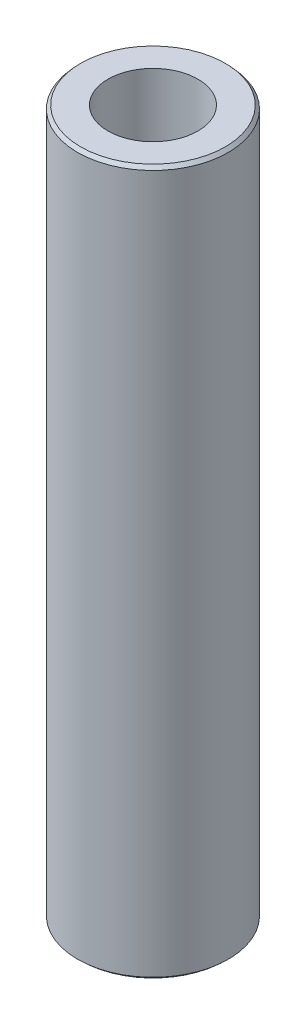
from build123d import *
from OCP.BRepFilletAPI import BRepFilletAPI_MakeChamfer

# Parameters (mm, degrees)
SKETCH1_R           = 15
BOSS_EXTRUDE1_DEPTH = 140.305806075
SKETCH2_R           = 8.947325173
CUT_EXTRUDE1_DEPTH  = 142.900384842
CHAMFER1_SIZE       = 0.668426378
CHAMFER1_SIZE2      = 0.600912813


with BuildPart() as part:
    # Sketch1 → Boss-Extrude1 (new body)
    with BuildSketch(Plane(origin=(0, 0, 0), x_dir=(1, 0, 0), z_dir=(0, 1, 0))):
        Circle(SKETCH1_R)
    extrude(amount=BOSS_EXTRUDE1_DEPTH)

    # Sketch2 → Cut-Extrude1 (cut, through all)
    with BuildSketch(Plane(origin=(0, 0, 0), x_dir=(1, 0, 0), z_dir=(0, 1, 0))):
        Circle(SKETCH2_R)
    extrude(amount=CUT_EXTRUDE1_DEPTH, mode=Mode.SUBTRACT)

    # Chamfer1: one chamfer whose edges measure the first distance from different faces: ONE call of the kernel's chamfer builder (chamfer() names one face for all edges)
    chamfer1_edges_1 = [part.edges().sort_by_distance(p)[0] for p in [
        (-15, 140.305806075, 0),
    ]]
    chamfer1_side_1 = [part.faces().sort_by_distance(p)[0] for p in [
        (-15, 70.152903038, 0),
    ]]
    chamfer1_edges_2 = [part.edges().sort_by_distance(p)[0] for p in [
        (-15, 0, 0),
    ]]
    chamfer1_side_2 = [part.faces().sort_by_distance(p)[0] for p in [
        (-14.575735931, 0, 0),
    ]]
    chamfer1 = BRepFilletAPI_MakeChamfer(part.part.solid().wrapped)
    for e in chamfer1_edges_1:
        chamfer1.Add(CHAMFER1_SIZE, CHAMFER1_SIZE2, e.wrapped, chamfer1_side_1[0].wrapped)  # the first distance lies on this face
    for e in chamfer1_edges_2:
        chamfer1.Add(CHAMFER1_SIZE, CHAMFER1_SIZE2, e.wrapped, chamfer1_side_2[0].wrapped)  # the first distance lies on this face
    add(Compound.cast(chamfer1.Shape()), mode=Mode.REPLACE)


solid = part.part
